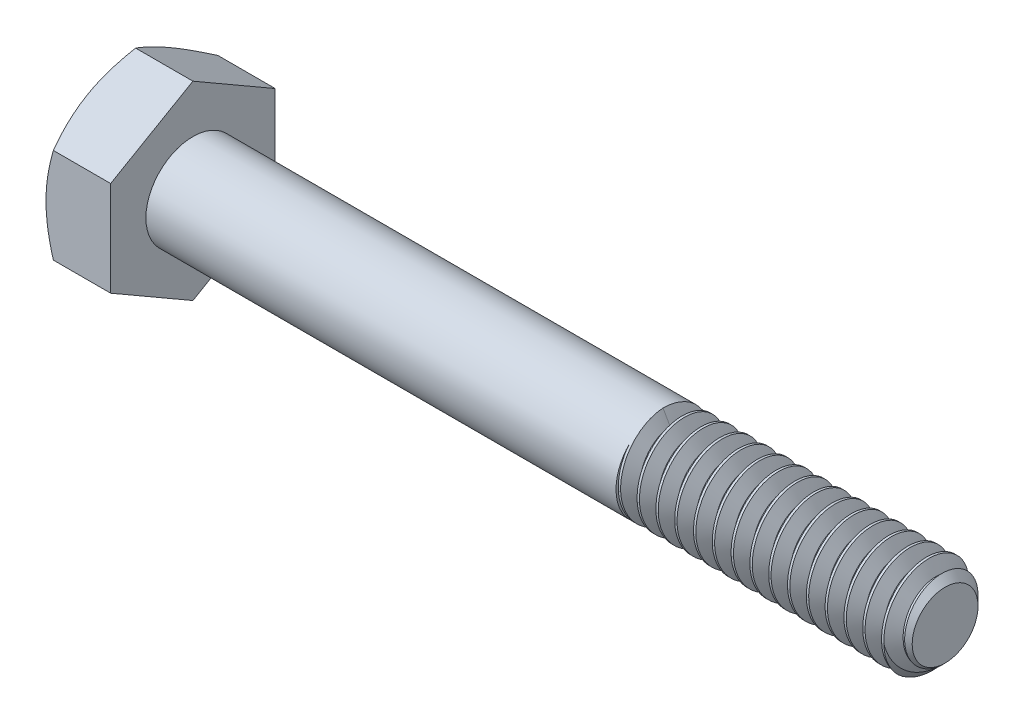
from build123d import *

# Parameters (mm, degrees)
SKETCH5_R           = 3.175
BOSS_EXTRUDE3_DEPTH = 50.8
CHAMFER1_SIZE       = 0.9525
BOSS_EXTRUDE4_DEPTH = 4.365625
SKETCH8_OUTSIDE_W   = 221.468
SKETCH8_OUTSIDE_H   = 223.188
SKETCH8_OUTSIDE_R   = 5.55625
CUT_EXTRUDE3_DEPTH  = 56.814699209
CUT_EXTRUDE3_DRAFT  = -60
CUT_EXTRUDE4_DEPTH  = 0.254
CIRPATTERN1_COUNT   = 6
CUT_SWEEP1_PITCH    = 1.27
CUT_SWEEP1_TO       = 19.05


with BuildPart() as part:
    # Sketch5 → Boss-Extrude3 (new body)
    with BuildSketch(Plane(origin=(27.5828125, 0, 0), x_dir=(0, 0, -1), z_dir=(1, 0, 0))):
        Circle(SKETCH5_R)
    extrude(amount=-BOSS_EXTRUDE3_DEPTH)

    # Chamfer1
    chamfer1_edges = [part.edges().sort_by_distance(p)[0] for p in [
        (27.5828125, 0, 3.175),
    ]]
    chamfer(chamfer1_edges, length=CHAMFER1_SIZE)

    # Sketch11 → Revolve1 (revolve)
    with BuildSketch(Plane.XY, mode=Mode.PRIVATE) as revolve1_sk:
        Polygon((-23.2171875, 3.175), (-23.2171875, 0), (11.7078125, 0), (8.5328125, 3.175), align=None)
    revolve(revolve1_sk.sketch.rotate(Axis((-23.2171875, 0, 0), (1, 0, 0)), 90), axis=Axis((-23.2171875, 0, 0), (1, 0, 0)))

    # Sketch6 → Boss-Extrude4 (add)
    with BuildSketch(Plane.ZY.offset(23.2171875)):
        Polygon((5.55625, 3.207902433), (0, 6.415804866), (-5.55625, 3.207902433), (-5.55625, -3.207902433), (0, -6.415804866), (5.55625, -3.207902433), align=None)
    extrude(amount=BOSS_EXTRUDE4_DEPTH)


with BuildPart() as cut_extrude3_tool:
    # Sketch8 outside → Cut-Extrude3 (with draft: the straight prism first)
    with BuildSketch(Plane.ZY.offset(27.5828125)):
        Rectangle(SKETCH8_OUTSIDE_W, SKETCH8_OUTSIDE_H)
        Circle(SKETCH8_OUTSIDE_R, mode=Mode.SUBTRACT)
    extrude(amount=-CUT_EXTRUDE3_DEPTH)
    # Cut-Extrude3: the draft: its side faces are tilted about the plane it starts from
    cut_extrude3_sides = [cut_extrude3_tool.faces().sort_by_distance(p)[0] for p in [
        (0.824537104, -111.594, 0),
        (0.824537104, 0, 110.734),
        (0.824537104, 111.594, 0),
        (0.824537104, 0, -110.734),
        (0.824537104, 0, -5.55625),
    ]]
    draft(cut_extrude3_sides, Plane.ZY.offset(27.5828125), CUT_EXTRUDE3_DRAFT)


with BuildPart() as part_1:
    add(part.part)

    # Cut-Extrude3: cut by cut_extrude3_tool
    add(cut_extrude3_tool.part, mode=Mode.SUBTRACT)

    # Sketch12 → Cut-Extrude4 (cut)
    with BuildSketch(Plane.ZY.offset(27.5828125)):
        with BuildLine():
            Line((0.1666875, 4.2783125), (0.1666875, 2.3891875))
            ThreePointArc((0.1666875, 2.3891875), (0, 2.2225), (-0.1666875, 2.3891875))
            Line((-0.1666875, 2.3891875), (-0.1666875, 4.2783125))
            ThreePointArc((-0.1666875, 4.2783125), (0, 4.445), (0.1666875, 4.2783125))
        make_face()
    cut_extrude4 = extrude(amount=-CUT_EXTRUDE4_DEPTH, mode=Mode.SUBTRACT)

    # CirPattern1: Cut-Extrude4 ×6 about axis
    cirpattern1_axis = Axis((0, 0, 0), (1, 0, 0))
    for i in range(1, CIRPATTERN1_COUNT):
        add(cut_extrude4.rotate(cirpattern1_axis, i * 360 / CIRPATTERN1_COUNT), mode=Mode.SUBTRACT)


with BuildPart() as body_2:
    # Split1: the piece on the far side of the plane
    add(part_1.part)
    split(bisect_by=Plane(origin=(8.5328125, 0, 0), x_dir=(0, 0, 1), z_dir=(1, 0, 0)), keep=Keep.BOTTOM)


with BuildPart() as part_2:
    add(part_1.part)

    # Split1
    split(bisect_by=Plane(origin=(8.5328125, 0, 0), x_dir=(0, 0, 1), z_dir=(1, 0, 0)), keep=Keep.TOP)

    # Cut-Sweep1: arcs per turn and ends read off the stored shape
    # Cut-Sweep1: the profile of Sketch10 profile screwed along a right-hand helix through 16 turns, 8 arcs to a turn; built about Z, then put on its axis
    cut_sweep1_z = Axis((0, 0, 0), (0, 0, 1))
    cut_sweep1_corners = [(3.1753, 0, 0.000173205), (2.350110803, 0, -0.47625), (2.350110803, 0, -0.635), (3.1753, 0, -1.111423205)]
    with BuildLine(mode=Mode.PRIVATE) as cut_sweep1_profile:
        Line(cut_sweep1_corners[0], cut_sweep1_corners[1])
        Line(cut_sweep1_corners[1], cut_sweep1_corners[2])
        Line(cut_sweep1_corners[2], cut_sweep1_corners[3])
        Line(cut_sweep1_corners[3], cut_sweep1_corners[0])
    cut_sweep1_cap = Face(cut_sweep1_profile.wire())
    cut_sweep1_turn_angles = [0, 22.5, 45, 67.5, 90, 112.5, 135, 157.5, 180, 202.5, 225, 247.5, 270, 292.5, 315, 337.5, 360]
    cut_sweep1_turn_weights = [1, 0.9238795325112867, 1, 0.9238795325112867, 1, 0.9238795325112867, 1, 0.9238795325112867, 1, 0.9238795325112867, 1, 0.9238795325112867, 1, 0.9238795325112867, 1, 0.9238795325112867, 1]
    cut_sweep1_turn_rails = [Edge.make_bspline([Vector(p[0], p[1], 0).rotate(cut_sweep1_z, cut_sweep1_turn_angles[k]) / cut_sweep1_turn_weights[k] + Vector(0, 0, p[2] + CUT_SWEEP1_PITCH * cut_sweep1_turn_angles[k] / 360) for k in range(17)], [0, 0, 0, 1, 1, 2, 2, 3, 3, 4, 4, 5, 5, 6, 6, 7, 7, 8, 8, 8], 2, cut_sweep1_turn_weights) for p in cut_sweep1_corners]
    cut_sweep1_turn_sides = [Face.make_surface_from_curves(cut_sweep1_turn_rails[p[0]], cut_sweep1_turn_rails[p[1]]) for p in [(0, 1), (1, 2), (2, 3), (3, 0)]]
    cut_sweep1 = Plane(origin=(27.5828125, 0, 0), x_dir=(0, 1, 0), z_dir=(-1, 0, 0)) * split(Solid(Shell([*[p.moved(Location((0, 0, CUT_SWEEP1_PITCH * i))) for i in range(16) for p in cut_sweep1_turn_sides], cut_sweep1_cap, cut_sweep1_cap.rotate(cut_sweep1_z, 5760).moved(Location((0, 0, CUT_SWEEP1_PITCH * 5760 / 360)))])), bisect_by=Plane.XY.offset(CUT_SWEEP1_TO), keep=Keep.BOTTOM, mode=Mode.PRIVATE)
    add(cut_sweep1, mode=Mode.SUBTRACT)


with BuildPart() as boss_extrude5_tool:
    # Boss-Extrude5: read off the stored shape, not the designer's step
    # Boss-Extrude5 outline → Boss-Extrude5 (revolve)
    with BuildSketch(Plane.YX):
        Polygon((3.175, 8.5328125), (2.35010135, 9.009067958), (2.35010135, 8.5328125), align=None)
    revolve(axis=Axis((0, 0, 0), (1, 0, 0)))


with BuildPart() as part_3:
    add(part_2.part)


with BuildPart() as part_4:
    # Boss-Extrude5: joined with boss_extrude5_tool
    add(part_3.part.fuse(boss_extrude5_tool.part, body_2.part, tol=0.00001))


solid = part_4.part
